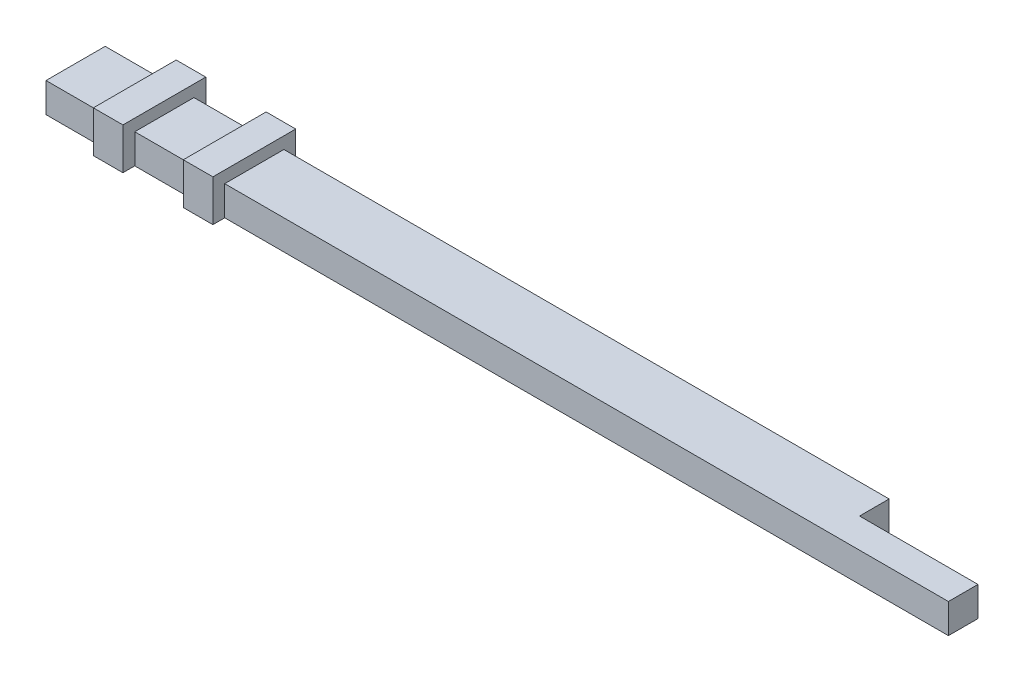
from build123d import *

# Parameters (mm, degrees)
BOSS_EXTRUDE1_DEPTH = 5
SKETCH2_W           = 14
SKETCH2_H           = 7
BOSS_EXTRUDE2_DEPTH = 5
SKETCH3_W           = 14
SKETCH3_H           = 7
BOSS_EXTRUDE3_DEPTH = 5


with BuildPart() as part:
    # Sketch1 → Boss-Extrude1 (new body)
    with BuildSketch(Plane(origin=(0, 0, 0), x_dir=(1, 0, 0), z_dir=(0, 1, 0))):
        Polygon((132.481495242, 10), (132.481495242, 5), (142.481495242, 5), (152.5, 5), (152.5, 0), (142.5, 0), (0, 0), (0, 10), align=None)
    extrude(amount=BOSS_EXTRUDE1_DEPTH)

    # Sketch2 → Boss-Extrude2 (add)
    with BuildSketch(Plane.ZY.offset(-10)):
        with Locations((-5, 3.5)):
            Rectangle(SKETCH2_W, SKETCH2_H)
    extrude(amount=-BOSS_EXTRUDE2_DEPTH)

    # Sketch3 → Boss-Extrude3 (add)
    with BuildSketch(Plane(origin=(30.2, 0, 0), x_dir=(0, 0, -1), z_dir=(1, 0, 0))):
        with Locations((5, 3.5)):
            Rectangle(SKETCH3_W, SKETCH3_H)
    extrude(amount=-BOSS_EXTRUDE3_DEPTH)


solid = part.part
